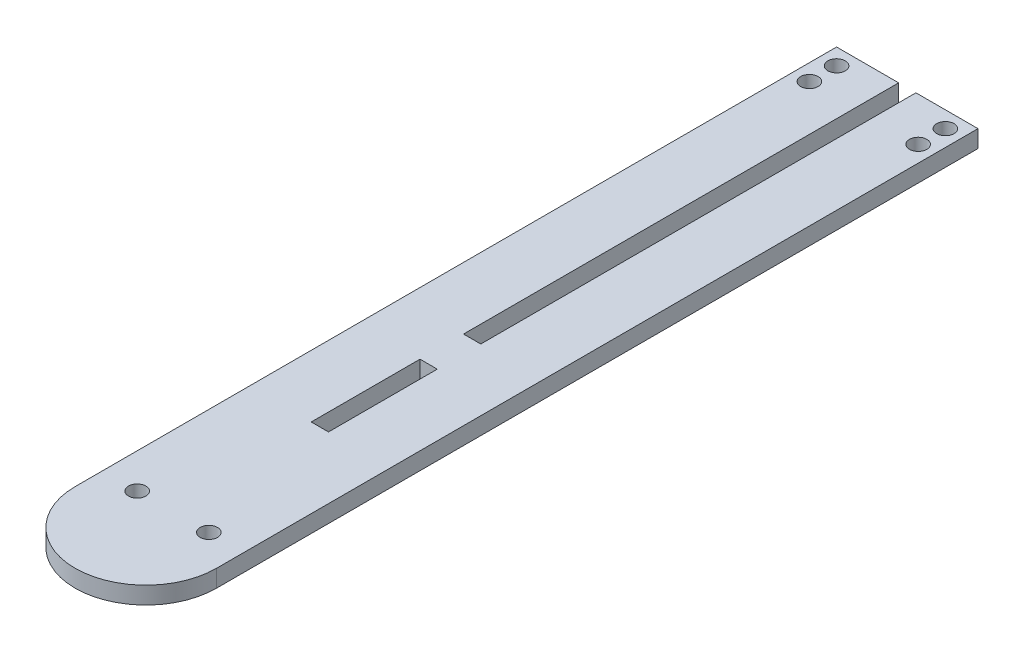
from build123d import *

# Parameters (mm, degrees)
SKETCH1_W               = 3.175
SKETCH1_H               = 20
BOSS_EXTRUDE1_DEPTH     = 3.175
CUT_EXTRUDE1_DEPTH      = 154.72662678
CUT_EXTRUDE1_DEPTH_BACK = 154.72662678
SKETCH2_R               = 1.6
CUT_EXTRUDE2_DEPTH      = 154.72662678
CUT_EXTRUDE2_DEPTH_BACK = 154.72662678
SKETCH3_R               = 1.6


with BuildPart() as part:
    # Sketch1 → Boss-Extrude1 (new body)
    with BuildSketch(Plane(origin=(0, 0, 0), x_dir=(1, 0, 0), z_dir=(0, 1, 0))):
        with BuildLine():
            Line((-14.5875, 0), (-14.5875, -140))
            ThreePointArc((-14.5875, -140), (-1.5875, -153), (11.4125, -140))
            Line((11.4125, -140), (11.4125, 0))
            Line((11.4125, 0), (0, 0))
            Line((0, 0), (0, -80))
            Line((0, -80), (-3.175, -80))
            Line((-3.175, -80), (-3.175, 0))
            Line((-3.175, 0), (-14.5875, 0))
        make_face()
        with Locations((-1.5875, -98)):
            Rectangle(SKETCH1_W, SKETCH1_H, mode=Mode.SUBTRACT)
    extrude(amount=BOSS_EXTRUDE1_DEPTH)

    # Sketch2 → Cut-Extrude1 (cut, two sides: drawn at the far end of the back side and taken through both)
    with BuildSketch(Plane(origin=(0, 3.175, 0), x_dir=(1, 0, 0), z_dir=(0, 1, 0)).offset(-CUT_EXTRUDE1_DEPTH_BACK)):
        with Locations((5, -135)):
            Circle(SKETCH2_R)
        with Locations((-8.175, -135)):
            Circle(SKETCH2_R)
    extrude(amount=CUT_EXTRUDE1_DEPTH + CUT_EXTRUDE1_DEPTH_BACK, mode=Mode.SUBTRACT)

    # Sketch3 → Cut-Extrude2 (cut, two sides: drawn at the far end of the back side and taken through both)
    with BuildSketch(Plane(origin=(0, 3.175, 0), x_dir=(1, 0, 0), z_dir=(0, 1, 0)).offset(-CUT_EXTRUDE2_DEPTH_BACK)):
        with Locations((-11.5875, -8)):
            Circle(SKETCH3_R)
        with Locations((-11.5875, -3)):
            Circle(SKETCH3_R)
        with Locations((8.4125, -8)):
            Circle(SKETCH3_R)
        with Locations((8.4125, -3)):
            Circle(SKETCH3_R)
    extrude(amount=CUT_EXTRUDE2_DEPTH + CUT_EXTRUDE2_DEPTH_BACK, mode=Mode.SUBTRACT)


solid = part.part
